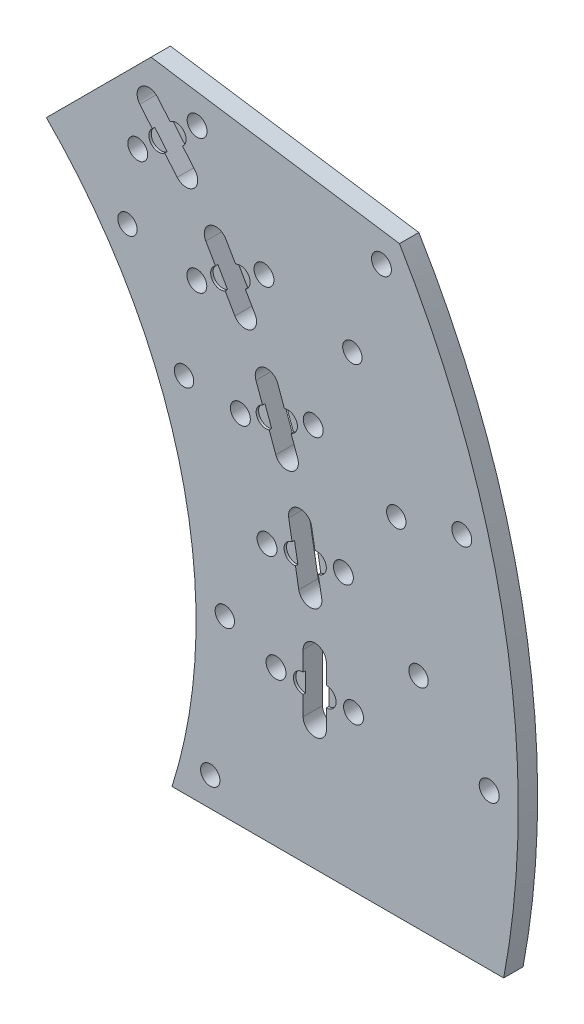
from build123d import *

# Parameters (mm, degrees)
SKETCH1_R           = 3.175
SKETCH1_R_2         = 3.2639
BOSS_EXTRUDE1_DEPTH = 6.35
SKETCH2_R           = 3.175
CUT_EXTRUDE1_DEPTH  = 0.79375


with BuildPart() as part:
    # Sketch1 → Boss-Extrude1 (new body)
    with BuildSketch(Plane.XY):
        with BuildLine():
            ThreePointArc((167.48125, 0), (165.496965553, -25.70454229), (159.591131024, -50.8))
            Line((159.591131024, -50.8), (268.282803213, -50.8))
            ThreePointArc((268.282803213, -50.8), (268.798556268, 47.996235774), (234.123018172, 140.508771477))
            Line((234.123018172, 140.508771477), (152.715190262, 152.715190262))
            Line((152.715190262, 152.715190262), (118.427127597, 118.427127597))
            ThreePointArc((118.427127597, 118.427127597), (154.732498954, 64.092299607), (167.48125, 0))
        make_face()
        with Locations((172.12665951, -41.275)):
            Circle(SKETCH1_R, mode=Mode.SUBTRACT)
        with Locations((193.675, 0)):
            Circle(SKETCH1_R_2, mode=Mode.SUBTRACT)
        with Locations((176.898422575, 6.177429038)):
            Circle(SKETCH1_R, mode=Mode.SUBTRACT)
        with Locations((190.732641565, 33.63131081)):
            Circle(SKETCH1_R_2, mode=Mode.SUBTRACT)
        with BuildLine():
            Line((202.565, -9.525), (202.565, 0))
            Line((202.565, 0), (202.565, 9.525))
            ThreePointArc((202.565, 9.525), (206.375, 13.335), (210.185, 9.525))
            Line((210.185, 9.525), (210.185, 0))
            Line((210.185, 0), (210.185, -9.525))
            ThreePointArc((210.185, -9.525), (206.375, -13.335), (202.565, -9.525))
        make_face(mode=Mode.SUBTRACT)
        with Locations((219.075, 0)):
            Circle(SKETCH1_R_2, mode=Mode.SUBTRACT)
        with Locations((263.525, 0)):
            Circle(SKETCH1_R_2, mode=Mode.SUBTRACT)
        with BuildLine():
            Line((201.141581381, 25.794749262), (199.487582489, 35.175043109))
            Line((199.487582489, 35.175043109), (197.833583597, 44.555336957))
            ThreePointArc((197.833583597, 44.555336957), (200.924101579, 48.969054052), (205.337818675, 45.87853607))
            Line((205.337818675, 45.87853607), (206.991817567, 36.498242223))
            Line((206.991817567, 36.498242223), (208.645816459, 27.117948375))
            ThreePointArc((208.645816459, 27.117948375), (205.555298477, 22.70423128), (201.141581381, 25.794749262))
        make_face(mode=Mode.SUBTRACT)
        with Locations((215.746758491, 38.041974522)):
            Circle(SKETCH1_R_2, mode=Mode.SUBTRACT)
        with Locations((240.38178065, 21.030680725)):
            Circle(SKETCH1_R, mode=Mode.SUBTRACT)
        with Locations((144.995031539, 101.526614087)):
            Circle(SKETCH1_R, mode=Mode.SUBTRACT)
        with Locations((163.532451502, 67.7373593)):
            Circle(SKETCH1_R, mode=Mode.SUBTRACT)
        with Locations((181.994968331, 66.240751259)):
            Circle(SKETCH1_R_2, mode=Mode.SUBTRACT)
        with BuildLine():
            Line((193.606577595, 60.33073812), (190.348835729, 69.281310333))
            Line((190.348835729, 69.281310333), (187.091093864, 78.231882546))
            ThreePointArc((187.091093864, 78.231882546), (189.368226003, 83.115208177), (194.251551635, 80.838076038))
            Line((194.251551635, 80.838076038), (197.5092935, 71.887503825))
            Line((197.5092935, 71.887503825), (200.767035365, 62.936931612))
            ThreePointArc((200.767035365, 62.936931612), (198.489903226, 58.053605981), (193.606577595, 60.33073812))
        make_face(mode=Mode.SUBTRACT)
        with Locations((167.727470078, 96.8375)):
            Circle(SKETCH1_R_2, mode=Mode.SUBTRACT)
        with Locations((148.363657521, 124.491890306)):
            Circle(SKETCH1_R_2, mode=Mode.SUBTRACT)
        with BuildLine():
            Line((180.188935918, 93.033608029), (175.426435918, 101.2825))
            Line((175.426435918, 101.2825), (170.663935918, 109.531391971))
            ThreePointArc((170.663935918, 109.531391971), (172.058492706, 114.735948759), (177.263049494, 113.341391971))
            Line((177.263049494, 113.341391971), (182.025549494, 105.0925))
            Line((182.025549494, 105.0925), (186.788049494, 96.843608029))
            ThreePointArc((186.788049494, 96.843608029), (185.393492706, 91.639051241), (180.188935918, 93.033608029))
        make_face(mode=Mode.SUBTRACT)
        with Locations((189.724515334, 109.5375)):
            Circle(SKETCH1_R_2, mode=Mode.SUBTRACT)
        with BuildLine():
            Line((161.296344603, 122.909698835), (155.17379262, 130.206272156))
            Line((155.17379262, 130.206272156), (149.051240638, 137.502845477))
            ThreePointArc((149.051240638, 137.502845477), (149.520849174, 142.870495598), (154.888499295, 142.400887063))
            Line((154.888499295, 142.400887063), (161.011051277, 135.104313742))
            Line((161.011051277, 135.104313742), (167.133603259, 127.807740421))
            ThreePointArc((167.133603259, 127.807740421), (166.663994724, 122.4400903), (161.296344603, 122.909698835))
        make_face(mode=Mode.SUBTRACT)
        with Locations((167.821186376, 140.818695592)):
            Circle(SKETCH1_R_2, mode=Mode.SUBTRACT)
        with Locations((205.863160899, 74.928062899)):
            Circle(SKETCH1_R_2, mode=Mode.SUBTRACT)
        with Locations((233.077901884, 62.453035583)):
            Circle(SKETCH1_R, mode=Mode.SUBTRACT)
        with Locations((254.545603373, 68.205288861)):
            Circle(SKETCH1_R_2, mode=Mode.SUBTRACT)
        with Locations((218.692069012, 101.977786558)):
            Circle(SKETCH1_R, mode=Mode.SUBTRACT)
        with Locations((228.219344532, 131.7625)):
            Circle(SKETCH1_R_2, mode=Mode.SUBTRACT)
    extrude(amount=BOSS_EXTRUDE1_DEPTH)

    # Sketch2 → Cut-Extrude1 (cut)
    with BuildSketch(Plane.XY.offset(6.35)):
        with Locations((202.565, 0)):
            Circle(SKETCH2_R)
        with Locations((210.185, 0)):
            Circle(SKETCH2_R)
        with Locations((199.487582489, 35.175043109)):
            Circle(SKETCH2_R)
        with Locations((206.991817567, 36.498242223)):
            Circle(SKETCH2_R)
        with Locations((190.348835729, 69.281310333)):
            Circle(SKETCH2_R)
        with Locations((197.5092935, 71.887503825)):
            Circle(SKETCH2_R)
        with Locations((175.426435918, 101.2825)):
            Circle(SKETCH2_R)
        with Locations((182.025549494, 105.0925)):
            Circle(SKETCH2_R)
        with Locations((155.17379262, 130.206272156)):
            Circle(SKETCH2_R)
        with Locations((161.011051277, 135.104313742)):
            Circle(SKETCH2_R)
    extrude(amount=-CUT_EXTRUDE1_DEPTH, mode=Mode.SUBTRACT)


solid = part.part
